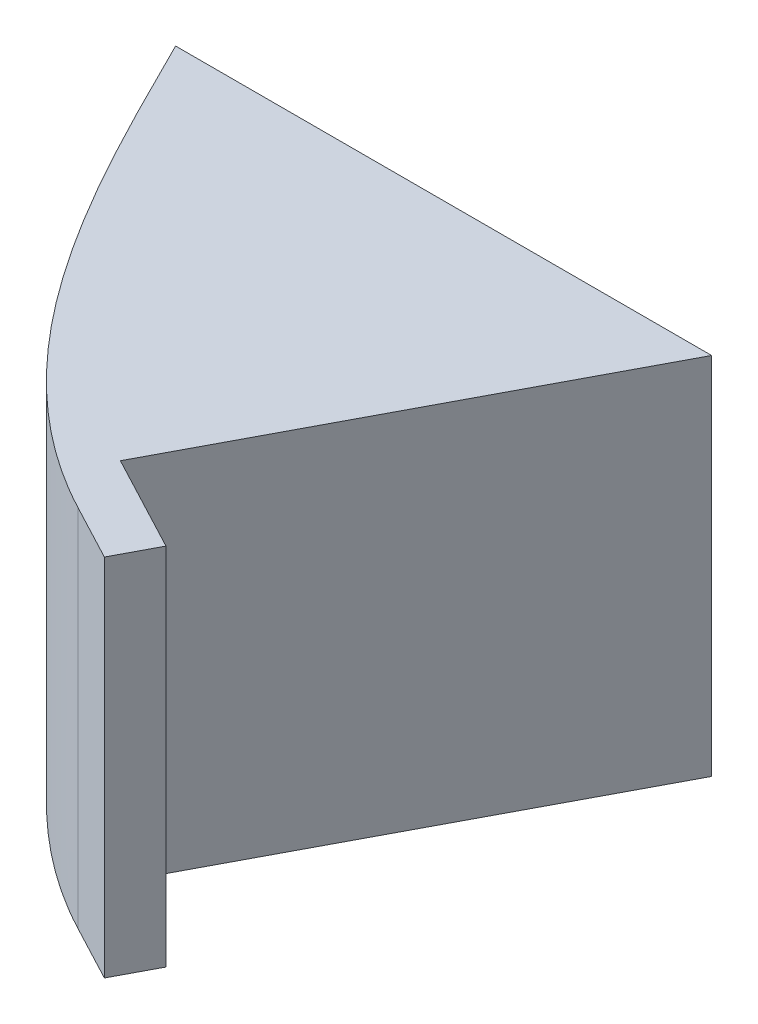
from build123d import *

# Parameters (mm, degrees)
BOSS_EXTRUDE1_DEPTH = 40


with BuildPart() as part:
    # Sketch1 → Boss-Extrude1 (new body)
    with BuildSketch(Plane(origin=(0, 0, 0), x_dir=(1, 0, 0), z_dir=(0, 1, 0))):
        with BuildLine():
            Line((-27.261465721, 0), (31.550575686, 0))
            Line((31.550575686, 0), (9.11863106, -42.435926528))
            Line((9.11863106, -42.435926528), (19.727612692, -48.043912685))
            Line((19.727612692, -48.043912685), (17.390951794, -52.464321698))
            Line((17.390951794, -52.464321698), (11.206296417, -49.195067123))
            add(Edge.make_bspline(
                [(11.206296417, -49.195067123), (-8.034341179, -39.024323783), (-18.223306344, -18.164852892), (-27.261465721, 0)],
                knots=[0, 0, 0, 0, 1, 1, 1, 1], degree=3))
        make_face()
    extrude(amount=BOSS_EXTRUDE1_DEPTH)


solid = part.part
